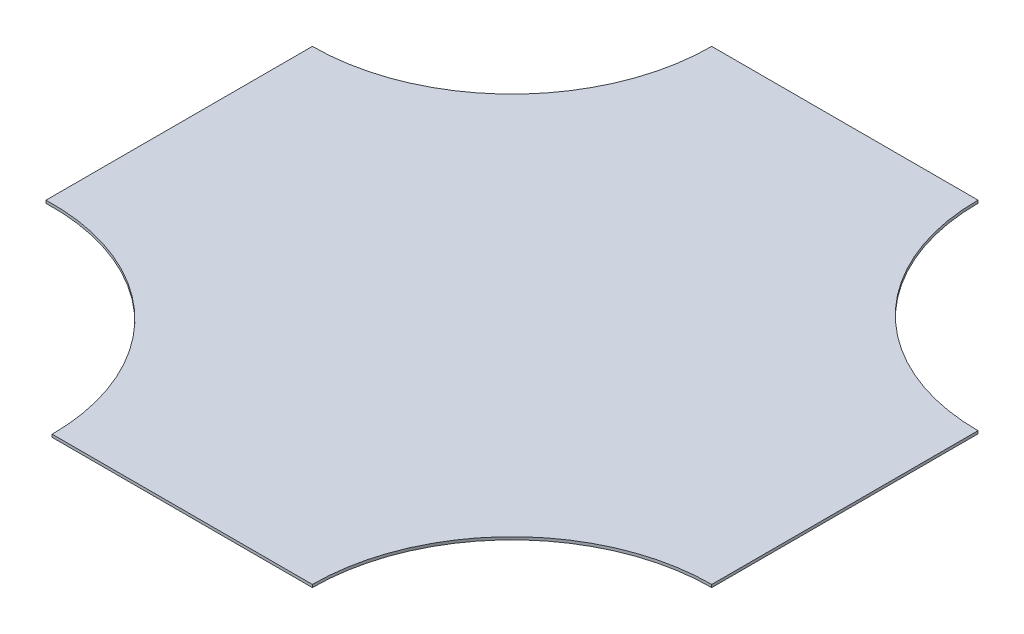
from build123d import *

# Parameters (mm, degrees)
BOSS_EXTRUDE1_DEPTH = 3.175


with BuildPart() as part:
    # Sketch1 → Boss-Extrude1 (new body)
    with BuildSketch(Plane(origin=(0, 0, 0), x_dir=(1, 0, 0), z_dir=(0, 1, 0))):
        with BuildLine():
            Line((-145.440228772, -381), (152.4, -381))
            ThreePointArc((152.4, -381), (219.355389821, -219.355389821), (381, -152.4))
            Line((381, -152.4), (381, 152.4))
            ThreePointArc((381, 152.4), (219.355389821, 219.355389821), (152.4, 381))
            Line((152.4, 381), (-152.4, 381))
            ThreePointArc((-152.4, 381), (-219.355389821, 219.355389821), (-381, 152.4))
            Line((-381, 152.4), (-381, -152.505970353))
            ThreePointArc((-381, -152.505970353), (-214.875288698, -216.913188064), (-145.440228772, -381))
        make_face()
    extrude(amount=BOSS_EXTRUDE1_DEPTH)


solid = part.part
